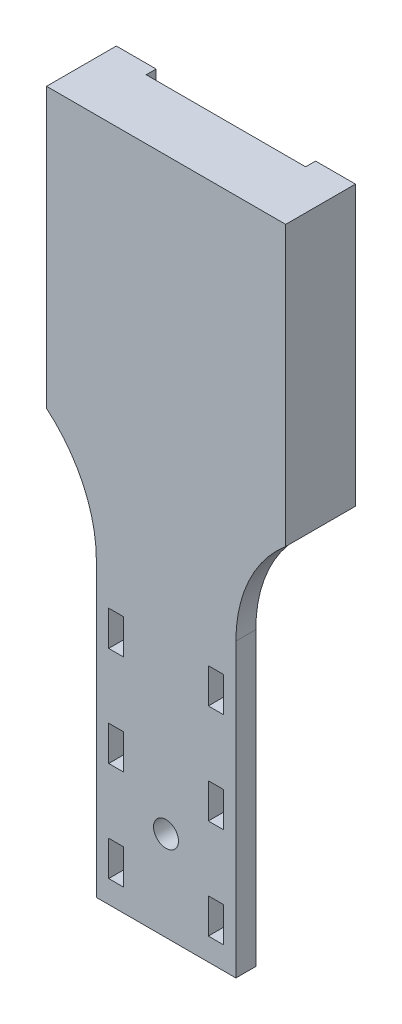
from build123d import *

# Parameters (mm, degrees)
SKETCH1_W                   = 24
SKETCH1_H                   = 6
BOSS_EXTRUDE1_DEPTH         = 27
CUT_EXTRUDE1_DEPTH          = 27
BOSS_EXTRUDE2_DEPTH         = 1
SKETCH4_W                   = 3
SKETCH4_H                   = 1
CUT_EXTRUDE2_DEPTH          = 8
FILLET1_R                   = 1
SKETCH5_W                   = 14
SKETCH5_H                   = 40
BOSS_EXTRUDE3_DEPTH         = 1
BOSS_EXTRUDE4_DEPTH         = 1
FILLET2_R                   = 14
SKETCH6_W                   = 1.5
SKETCH6_H                   = 3.5
CUT_EXTRUDE3_DEPTH          = 3
TAP_DRILL_FOR_M3X0_5_TAP1_D = 2.5
FILLET3_R                   = 0.5


with BuildPart() as part:
    # Sketch1 → Boss-Extrude1 (new body)
    with BuildSketch(Plane(origin=(0, 0, 0), x_dir=(1, 0, 0), z_dir=(0, 1, 0))):
        with Locations((12, 3)):
            Rectangle(SKETCH1_W, SKETCH1_H)
    extrude(amount=BOSS_EXTRUDE1_DEPTH)

    # Sketch2 → Cut-Extrude1 (cut)
    with BuildSketch(Plane(origin=(0, 27, 0), x_dir=(1, 0, 0), z_dir=(0, 1, 0))):
        Polygon((1, 1), (23, 1), (23, 5), (20, 5), (20, 7.622720443), (4, 7.622720443), (4, 5), (1, 5), align=None)
    extrude(amount=-CUT_EXTRUDE1_DEPTH, mode=Mode.SUBTRACT)

    # Sketch3 → Boss-Extrude2 (add)
    with BuildSketch(Plane(origin=(0, 27, 0), x_dir=(1, 0, 0), z_dir=(0, 1, 0))):
        Polygon((24, 0), (24, 5), (24, 6), (20, 6), (20, 5), (4, 5), (4, 6), (0, 6), (0, 5), (0, 0), align=None)
    extrude(amount=BOSS_EXTRUDE2_DEPTH)

    # Sketch4 → Cut-Extrude2 (cut)
    with BuildSketch(Plane.XZ):
        with Locations((2.5, -5.5)):
            Rectangle(SKETCH4_W, SKETCH4_H)
        with Locations((21.5, -5.5)):
            Rectangle(SKETCH4_W, SKETCH4_H)
    extrude(amount=-CUT_EXTRUDE2_DEPTH, mode=Mode.SUBTRACT)

    # Fillet1
    fillet1_edges = [part.edges().sort_by_distance(p)[0] for p in [
        (1, 8, -5.5),
        (23, 8, -5.5),
    ]]
    fillet(fillet1_edges, radius=FILLET1_R)

    # Sketch5 → Boss-Extrude3 (add)
    with BuildSketch(Plane.XY):
        with Locations((12, -20)):
            Rectangle(SKETCH5_W, SKETCH5_H)
    extrude(amount=-BOSS_EXTRUDE3_DEPTH)

    # Sketch7 → Boss-Extrude4 (add)
    with BuildSketch(Plane.XY):
        Polygon((0, 28), (0, 0), (5, 0), (5, -40), (19, -40), (19, 0), (24, 0), (24, 28), align=None)
    extrude(amount=BOSS_EXTRUDE4_DEPTH)

    # Fillet2
    # the kernel refuses this fillet: 14 mm, written as the material it adds along each edge
    with BuildSketch(Plane(origin=(19, 0, -27.809513237), x_dir=(0, -1, 0), z_dir=(0, 0, 1))) as fillet2_piece_1_section:
        with BuildLine():
            CenterArc((10.723805295, 14), FILLET2_R, 220.005200885, 49.994799115)
            Line((0, 5), (-0.214476106, 4.82))
            ThreePointArc((-0.214476106, 4.82), (-0.28, 2.5), (-0.28, 0))
            Line((-0.28, 0), (0, -0.28))
            Line((0, -0.28), (10.723805295, -0.28))
            Line((10.723805295, -0.28), (10.723805295, 0))
        make_face()
    fillet2_piece_1 = extrude(amount=28.809513237, mode=Mode.PRIVATE)
    fillet2_piece_1 = split(fillet2_piece_1, bisect_by=Plane(origin=(23.365169803, -0.171945875, -1), z_dir=(0, 0, -1)), keep=Keep.TOP, mode=Mode.PRIVATE)
    fillet2_piece_1 = split(fillet2_piece_1, bisect_by=Plane(origin=(23.365169803, -0.171945875, -6), z_dir=(0, 0, 1)), keep=Keep.TOP, mode=Mode.PRIVATE)
    fillet2_piece_1 = split(fillet2_piece_1, bisect_by=Plane(origin=(23, -0.171945875, -3.5), z_dir=(1, 0, 0)), keep=Keep.TOP, mode=Mode.PRIVATE)
    add(fillet2_piece_1)
    with BuildSketch(Plane(origin=(19, 0, -1), x_dir=(0, -1, 0), z_dir=(0, 0, 1))) as fillet2_piece_2_section:
        with BuildLine():
            CenterArc((10.723805295, 14), FILLET2_R, 220.005200885, 49.994799115)
            Line((0, 5), (-0.214476106, 4.82))
            ThreePointArc((-0.214476106, 4.82), (-0.28, 2.5), (-0.28, 0))
            Line((-0.28, 0), (0, -0.28))
            Line((0, -0.28), (10.723805295, -0.28))
            Line((10.723805295, -0.28), (10.723805295, 0))
        make_face()
    fillet2_piece_2 = extrude(amount=2, mode=Mode.PRIVATE)
    fillet2_piece_2 = split(fillet2_piece_2, bisect_by=Plane(origin=(23, -2.887653154, 0), z_dir=(-1, 0, 0)), keep=Keep.TOP, mode=Mode.PRIVATE)
    add(fillet2_piece_2)
    with BuildSketch(Plane(origin=(19, 0, -1), x_dir=(0, -1, 0), z_dir=(0, 0, 1))) as fillet2_piece_3_section:
        with BuildLine():
            CenterArc((10.723805295, 14), FILLET2_R, 220.005200885, 49.994799115)
            Line((0, 5), (-0.214476106, 4.82))
            ThreePointArc((-0.214476106, 4.82), (-0.28, 2.5), (-0.28, 0))
            Line((-0.28, 0), (0, -0.28))
            Line((0, -0.28), (10.723805295, -0.28))
            Line((10.723805295, -0.28), (10.723805295, 0))
        make_face()
    fillet2_piece_3 = extrude(amount=2, mode=Mode.PRIVATE)
    fillet2_piece_3 = split(fillet2_piece_3, bisect_by=Plane(origin=(23, -0.171945875, 0), z_dir=(1, 0, 0)), keep=Keep.TOP, mode=Mode.PRIVATE)
    add(fillet2_piece_3)
    with BuildSketch(Plane(origin=(5, 0, -27.809513237), x_dir=(-1, 0, 0), z_dir=(0, 0, 1))) as fillet2_piece_4_section:
        with BuildLine():
            CenterArc((14, 10.723805295), FILLET2_R, 180, 49.994799115)
            Line((0, 10.723805295), (-0.28, 10.723805295))
            Line((-0.28, 10.723805295), (-0.28, 0))
            Line((-0.28, 0), (0, -0.28))
            ThreePointArc((0, -0.28), (2.5, -0.28), (4.82, -0.214476106))
            Line((4.82, -0.214476106), (5, 0))
        make_face()
    fillet2_piece_4 = extrude(amount=28.809513237, mode=Mode.PRIVATE)
    fillet2_piece_4 = split(fillet2_piece_4, bisect_by=Plane(origin=(1, -0.171945875, -3.5), z_dir=(-1, 0, 0)), keep=Keep.TOP, mode=Mode.PRIVATE)
    fillet2_piece_4 = split(fillet2_piece_4, bisect_by=Plane(origin=(0.634830197, -0.171945875, -6), z_dir=(0, 0, 1)), keep=Keep.TOP, mode=Mode.PRIVATE)
    fillet2_piece_4 = split(fillet2_piece_4, bisect_by=Plane(origin=(0.634830197, -0.171945875, -1), z_dir=(0, 0, -1)), keep=Keep.TOP, mode=Mode.PRIVATE)
    add(fillet2_piece_4)
    with BuildSketch(Plane(origin=(5, 0, -1), x_dir=(-1, 0, 0), z_dir=(0, 0, 1))) as fillet2_piece_5_section:
        with BuildLine():
            CenterArc((14, 10.723805295), FILLET2_R, 180, 49.994799115)
            Line((0, 10.723805295), (-0.28, 10.723805295))
            Line((-0.28, 10.723805295), (-0.28, 0))
            Line((-0.28, 0), (0, -0.28))
            ThreePointArc((0, -0.28), (2.5, -0.28), (4.82, -0.214476106))
            Line((4.82, -0.214476106), (5, 0))
        make_face()
    fillet2_piece_5 = extrude(amount=2, mode=Mode.PRIVATE)
    fillet2_piece_5 = split(fillet2_piece_5, bisect_by=Plane(origin=(1, -0.171945875, 0), z_dir=(-1, 0, 0)), keep=Keep.TOP, mode=Mode.PRIVATE)
    add(fillet2_piece_5)
    with BuildSketch(Plane(origin=(5, 0, -1), x_dir=(-1, 0, 0), z_dir=(0, 0, 1))) as fillet2_piece_6_section:
        with BuildLine():
            CenterArc((14, 10.723805295), FILLET2_R, 180, 49.994799115)
            Line((0, 10.723805295), (-0.28, 10.723805295))
            Line((-0.28, 10.723805295), (-0.28, 0))
            Line((-0.28, 0), (0, -0.28))
            ThreePointArc((0, -0.28), (2.5, -0.28), (4.82, -0.214476106))
            Line((4.82, -0.214476106), (5, 0))
        make_face()
    fillet2_piece_6 = extrude(amount=2, mode=Mode.PRIVATE)
    fillet2_piece_6 = split(fillet2_piece_6, bisect_by=Plane(origin=(1, -2.887653154, 0), z_dir=(1, 0, 0)), keep=Keep.TOP, mode=Mode.PRIVATE)
    add(fillet2_piece_6)

    # Sketch6 → Cut-Extrude3 (cut)
    with BuildSketch(Plane(origin=(0, 0, -1), x_dir=(-1, 0, 0), z_dir=(0, 0, -1))):
        with Locations((-6.986389138, -35.987474117)):
            Rectangle(SKETCH6_W, SKETCH6_H)
        with Locations((-16.986389138, -35.987474117)):
            Rectangle(SKETCH6_W, SKETCH6_H)
        with Locations((-6.986389138, -25.987474117)):
            Rectangle(SKETCH6_W, SKETCH6_H)
        with Locations((-16.986389138, -25.987474117)):
            Rectangle(SKETCH6_W, SKETCH6_H)
        with Locations((-16.986389138, -15.987474117)):
            Rectangle(SKETCH6_W, SKETCH6_H)
        with Locations((-6.986389138, -15.987474117)):
            Rectangle(SKETCH6_W, SKETCH6_H)
    extrude(amount=-CUT_EXTRUDE3_DEPTH, mode=Mode.SUBTRACT)

    # Tap Drill for M3x0.5 Tap1 (through all)
    with Locations(Plane.XY.offset(1)):
        with Locations((11.986389138, -30.987474117)):
            Hole(TAP_DRILL_FOR_M3X0_5_TAP1_D / 2)

    # Fillet3
    fillet3_edges = [part.edges().sort_by_distance(p)[0] for p in [
        (23, -0.925846324, -3.5),
        (1, -0.925846324, -3.5),
        (4, 8, -5.5),
        (20, 8, -5.5),
    ]]
    fillet(fillet3_edges, radius=FILLET3_R)


solid = part.part
